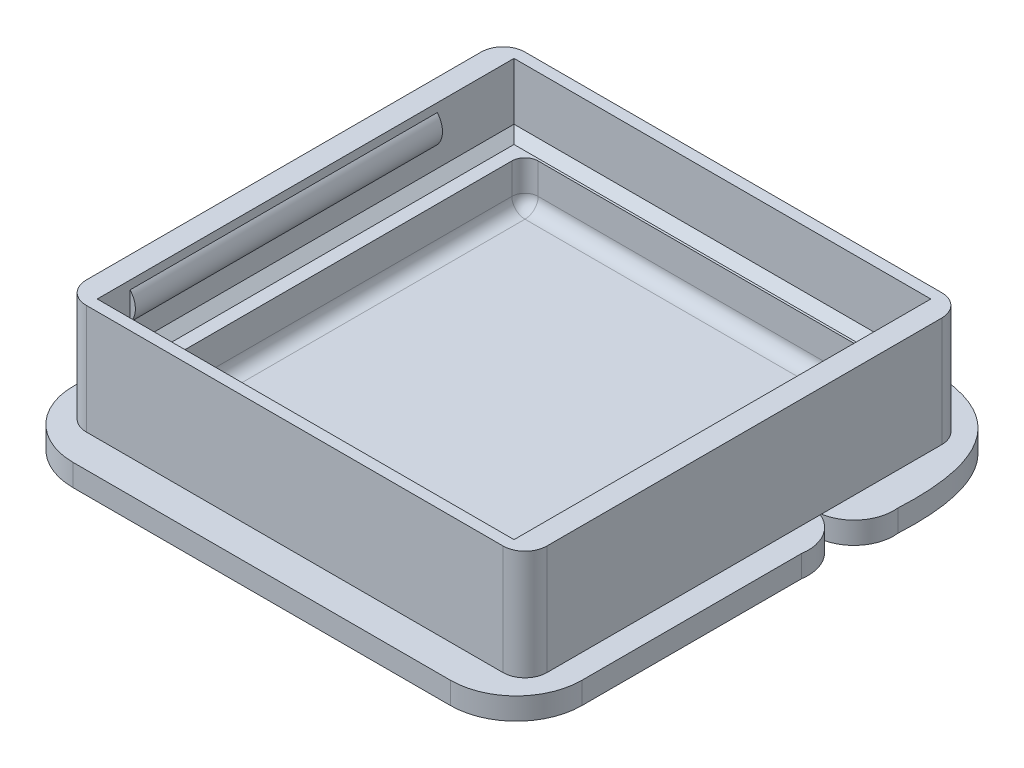
from build123d import *

# Parameters (mm, degrees)
BOSS_EXTRUDE1_DEPTH      = 6.35
SKETCH3_W                = 133.35
SKETCH3_H                = 127
SKETCH3_W_2              = 107.95
SKETCH3_H_2              = 114.3
BOSS_EXTRUDE2_DEPTH      = 12.7
SKETCH4_W                = 133.35
SKETCH4_H                = 127
SKETCH4_W_2              = 120.65
SKETCH4_H_2              = 120.65
BOSS_EXTRUDE3_DEPTH      = 19.05
FILLET1_R                = 6.35
FILLET2_R                = 3.81
BOSS_EXTRUDE4_DEPTH      = 50.8
BOSS_EXTRUDE4_DEPTH_BACK = 38.1
CHAMFER1_SIZE            = 2.54
CUT_EXTRUDE1_DEPTH       = 2.54
FILLET3_R                = 3.81


with BuildPart() as part:
    # Sketch2 → Boss-Extrude1 (new body)
    with BuildSketch(Plane(origin=(0, 0, 0), x_dir=(1, 0, 0), z_dir=(0, 1, 0))):
        with BuildLine():
            ThreePointArc((-76.2, 34.925), (-73.750256121, 26.470795103), (-66.04, 22.225))
            ThreePointArc((-66.04, 22.225), (-71.103893825, 18.75335434), (-73.66, 13.171090867))
            Line((-73.66, 13.171090867), (-73.66, -53.975))
            ThreePointArc((-73.66, -53.975), (-68.080384182, -67.445384182), (-54.61, -73.025))
            Line((-54.61, -73.025), (54.61, -73.025))
            ThreePointArc((54.61, -73.025), (68.080384182, -67.445384182), (73.66, -53.975))
            Line((73.66, -53.975), (73.66, 9.525))
            ThreePointArc((73.66, 9.525), (72.166535166, 17.2649211), (66.04, 22.225))
            ThreePointArc((66.04, 22.225), (73.750256121, 26.470795103), (76.2, 34.925))
            add(Edge.make_bspline(
                [(54.26154132, 73.334062346), (78.033661383, 68.772092229), (76.2, 34.925)],
                knots=[0, 0, 0, 1, 1, 1], degree=2))
            ThreePointArc((54.26154132, 73.334062346), (0, 79.119757765), (-54.26154132, 73.334062346))
            add(Edge.make_bspline(
                [(-54.26154132, 73.334062346), (-78.033661383, 68.772092229), (-76.2, 34.925)],
                knots=[0, 0, 0, 1, 1, 1], degree=2))
        make_face()
    extrude(amount=BOSS_EXTRUDE1_DEPTH)

    # Sketch3 → Boss-Extrude2 (add)
    with BuildSketch(Plane(origin=(0, 6.35, 0), x_dir=(1, 0, 0), z_dir=(0, 1, 0))):
        Rectangle(SKETCH3_W, SKETCH3_H)
        Rectangle(SKETCH3_W_2, SKETCH3_H_2, mode=Mode.SUBTRACT)
    extrude(amount=BOSS_EXTRUDE2_DEPTH)

    # Sketch4 → Boss-Extrude3 (add)
    with BuildSketch(Plane(origin=(0, 19.05, 0), x_dir=(1, 0, 0), z_dir=(0, 1, 0))):
        Rectangle(SKETCH4_W, SKETCH4_H)
        Rectangle(SKETCH4_W_2, SKETCH4_H_2, mode=Mode.SUBTRACT)
    extrude(amount=BOSS_EXTRUDE3_DEPTH)

    # Fillet1
    fillet1_edges = [part.edges().sort_by_distance(p)[0] for p in [
        (66.675, 22.225, 63.5),
        (66.675, 22.225, -63.5),
        (-66.675, 22.225, -63.5),
        (-66.675, 22.225, 63.5),
    ]]
    fillet(fillet1_edges, radius=FILLET1_R)

    # Fillet2
    fillet2_edges = [part.edges().sort_by_distance(p)[0] for p in [
        (53.975, 6.35, 0),
        (0, 6.35, -57.15),
        (-53.975, 6.35, 0),
        (0, 6.35, 57.15),
    ]]
    fillet(fillet2_edges, radius=FILLET2_R)

    # Sketch5 → Boss-Extrude4 (add, two sides: drawn at the far end of the back side and taken through both)
    with BuildSketch(Plane.XY.offset(-BOSS_EXTRUDE4_DEPTH_BACK)):
        with BuildLine():
            Line((60.325, 35.622124998), (60.325, 27.557875002))
            ThreePointArc((60.325, 27.557875002), (58.801, 31.59), (60.325, 35.622124998))
        make_face()
        with BuildLine():
            Line((-60.325, 35.622124998), (-60.325, 27.557875002))
            ThreePointArc((-60.325, 27.557875002), (-58.801, 31.59), (-60.325, 35.622124998))
        make_face()
    extrude(amount=BOSS_EXTRUDE4_DEPTH + BOSS_EXTRUDE4_DEPTH_BACK)

    # Chamfer1
    chamfer1_edges = [part.edges().sort_by_distance(p)[0] for p in [
        (60.325, 19.05, 0),
        (0, 19.05, -60.325),
        (-60.325, 19.05, 0),
        (0, 19.05, 60.325),
    ]]
    chamfer(chamfer1_edges, length=CHAMFER1_SIZE)

    # Sketch6 → Cut-Extrude1 (cut)
    with BuildSketch(Plane.XZ):
        with BuildLine():
            Line((-8.66439326, 21.686134934), (-9.134144863, 21.256347274))
            add(Edge.make_bspline(
                [(-9.134144863, 21.256347274), (-9.154267007, 21.284731651), (-9.192898718, 21.339225695), (-9.255516693, 21.412194506), (-9.317851915, 21.474442331), (-9.380481882, 21.525709129), (-9.443961724, 21.565683416), (-9.508181248, 21.593985652), (-9.572776375, 21.611977652), (-9.61617433, 21.614218089), (-9.637550312, 21.615321633)],
                knots=[0, 0, 0, 0, 1.299362458, 2.494594718, 3.587462134, 4.587049575, 5.512617175, 6.380583204, 7.202344345, 8, 8, 8, 8], degree=3))
            add(Edge.make_bspline(
                [(-9.637550312, 21.615321633), (-9.657489214, 21.614622377), (-9.695985996, 21.613272298), (-9.750866016, 21.599852609), (-9.799589278, 21.576692196), (-9.842108233, 21.546408009), (-9.875789517, 21.509922584), (-9.902681412, 21.471658754), (-9.917823808, 21.42942414), (-9.919816845, 21.400415703), (-9.920803517, 21.386054806)],
                knots=[0, 0, 0, 0, 1.185010067, 2.2879431, 3.333075148, 4.379039566, 5.372662701, 6.27520591, 7.14612461, 8, 8, 8, 8], degree=3))
            add(Edge.make_bspline(
                [(-9.920803517, 21.386054806), (-9.92018522, 21.371486819), (-9.918940055, 21.342148916), (-9.906913461, 21.299150566), (-9.88878595, 21.257136173), (-9.871464373, 21.231560013), (-9.862610408, 21.218486697)],
                knots=[0, 0, 0, 0, 0.967525499, 1.948461899, 2.951351359, 4, 4, 4, 4], degree=3))
            add(Edge.make_bspline(
                [(-9.862610408, 21.218486697), (-9.854561195, 21.208324945), (-9.836032971, 21.184933935), (-9.800703442, 21.147886221), (-9.756336973, 21.102499528), (-9.701226249, 21.050334572), (-9.637659069, 20.989515298), (-9.56268901, 20.922432533), (-9.478474038, 20.847008802), (-9.418615988, 20.794486448), (-9.387249831, 20.766964261)],
                knots=[0, 0, 0, 0, 0.473873513, 1.090794244, 1.870441696, 2.795289791, 3.865433203, 5.087734844, 6.473946851, 8, 8, 8, 8], degree=3))
            add(Edge.make_bspline(
                [(-9.387249831, 20.766964261), (-9.35780818, 20.741483998), (-9.301934044, 20.693127752), (-9.222436245, 20.624493824), (-9.152570919, 20.562745553), (-9.091320289, 20.508809648), (-9.039612854, 20.462120197), (-8.997231237, 20.422454026), (-8.963657817, 20.390583363), (-8.944573293, 20.371333463), (-8.936428517, 20.363118107)],
                knots=[0, 0, 0, 0, 1.543621617, 2.929473131, 4.163658386, 5.240097082, 6.164993805, 6.925417477, 7.541396219, 8, 8, 8, 8], degree=3))
            add(Edge.make_bspline(
                [(-8.936428517, 20.363118107), (-8.905528932, 20.329678139), (-8.846129079, 20.265394777), (-8.768930211, 20.165775782), (-8.705393044, 20.06852733), (-8.656239488, 19.971819534), (-8.619116745, 19.874257093), (-8.592944719, 19.773447293), (-8.577270119, 19.668336735), (-8.575529872, 19.596611611), (-8.57464967, 19.560333652)],
                knots=[0, 0, 0, 0, 1.206664779, 2.319633467, 3.337109185, 4.282041471, 5.190008762, 6.099243693, 7.03861361, 8, 8, 8, 8], degree=3))
            add(Edge.make_bspline(
                [(-8.57464967, 19.560333652), (-8.575276176, 19.524985231), (-8.576505402, 19.455630312), (-8.59156107, 19.35413972), (-8.613029568, 19.257008818), (-8.646223633, 19.165294529), (-8.686680363, 19.07749139), (-8.737398716, 18.994967094), (-8.796960468, 18.916886463), (-8.865227381, 18.844645283), (-8.940738693, 18.779091419), (-9.021731751, 18.720733822), (-9.108998547, 18.672552191), (-9.201793487, 18.632878055), (-9.300066899, 18.602320505), (-9.403701711, 18.579735628), (-9.512856439, 18.566180541), (-9.587498015, 18.564763517), (-9.625631241, 18.564039582)],
                knots=[0, 0, 0, 0, 1.043214005, 2.046824704, 3.02475056, 3.976699089, 4.921714032, 5.875962561, 6.831408892, 7.817874052, 8.806269674, 9.781291748, 10.760897367, 11.74438705, 12.757449933, 13.795994037, 14.874007457, 16, 16, 16, 16], degree=3))
            add(Edge.make_bspline(
                [(-9.625631241, 18.564039582), (-9.655565499, 18.564570635), (-9.714852496, 18.565622426), (-9.802232568, 18.574209423), (-9.886607905, 18.588067922), (-9.967883465, 18.607931291), (-10.046425411, 18.633100874), (-10.122236967, 18.663844555), (-10.194794781, 18.70063885), (-10.26464786, 18.742727121), (-10.331456632, 18.791597149), (-10.396065866, 18.8462498), (-10.457833804, 18.907525658), (-10.517057104, 18.975279807), (-10.573356839, 19.049704111), (-10.628575901, 19.129762074), (-10.680260189, 19.216939462), (-10.712187872, 19.278095105), (-10.728495824, 19.30933205)],
                knots=[0, 0, 0, 0, 1.016823716, 2.013894106, 2.979844003, 3.91962641, 4.853723003, 5.779685073, 6.695824784, 7.614987388, 8.547259901, 9.504950863, 10.487499108, 11.500346958, 12.559593716, 13.656357062, 14.802919212, 16, 16, 16, 16], degree=3))
            Line((-10.728495824, 19.30933205), (-10.17601185, 19.640962659))
            add(Edge.make_bspline(
                [(-10.17601185, 19.640962659), (-10.155613039, 19.605504645), (-10.116506776, 19.537528602), (-10.050237557, 19.446194173), (-9.982348125, 19.367981353), (-9.911268937, 19.304272559), (-9.83786429, 19.254215922), (-9.761779623, 19.218441977), (-9.682961479, 19.196297945), (-9.62927414, 19.193593648), (-9.602494222, 19.19224471)],
                knots=[0, 0, 0, 0, 1.283663364, 2.460892379, 3.537111102, 4.529833553, 5.449777664, 6.316464042, 7.160231139, 8, 8, 8, 8], degree=3))
            add(Edge.make_bspline(
                [(-9.602494222, 19.19224471), (-9.575255211, 19.193346326), (-9.522407562, 19.19548362), (-9.446974307, 19.215225167), (-9.377814242, 19.246220845), (-9.318032793, 19.290447402), (-9.267413631, 19.341491571), (-9.230053784, 19.398280543), (-9.206584076, 19.45972484), (-9.204102759, 19.50240809), (-9.202854799, 19.523875319)],
                knots=[0, 0, 0, 0, 1.13588714, 2.203786484, 3.234766741, 4.283437687, 5.291419208, 6.222934724, 7.106237994, 8, 8, 8, 8], degree=3))
            add(Edge.make_bspline(
                [(-9.202854799, 19.523875319), (-9.204007239, 19.543847082), (-9.206348311, 19.584417807), (-9.223591927, 19.644739952), (-9.250548958, 19.705034663), (-9.282441027, 19.754490017), (-9.3148952, 19.795897643), (-9.34592871, 19.831775479), (-9.383719316, 19.871414206), (-9.428171197, 19.914863687), (-9.478697028, 19.96250642), (-9.535339371, 20.014337738), (-9.59874684, 20.069901069), (-9.643563364, 20.107750262), (-9.666997427, 20.127541184)],
                knots=[0, 0, 0, 0, 0.916159276, 1.861089862, 2.860218735, 3.940849679, 4.552606315, 5.27541173, 6.11797699, 7.06649574, 8.129236253, 9.306560635, 10.591630461, 12, 12, 12, 12], degree=3))
            add(Edge.make_bspline(
                [(-9.666997427, 20.127541184), (-9.711546513, 20.165233983), (-9.797049694, 20.237577873), (-9.917876537, 20.344427522), (-10.02675234, 20.444288308), (-10.122736737, 20.538394731), (-10.207052716, 20.625008863), (-10.279129254, 20.704834216), (-10.338174556, 20.778486535), (-10.400307004, 20.865722778), (-10.459345253, 20.972026134), (-10.510371054, 21.099921394), (-10.543474439, 21.227800426), (-10.547183213, 21.313651365), (-10.549008645, 21.355906569)],
                knots=[0, 0, 0, 0, 1.345494975, 2.582412109, 3.71882943, 4.751509156, 5.681369928, 6.505683931, 7.230279997, 7.856715994, 8.973648664, 10.023341002, 11.027102913, 12, 12, 12, 12], degree=3))
            add(Edge.make_bspline(
                [(-10.549008645, 21.355906569), (-10.54824945, 21.385871691), (-10.546753756, 21.444906201), (-10.533411928, 21.531707846), (-10.513472059, 21.615464141), (-10.484513644, 21.695869503), (-10.446929119, 21.772823222), (-10.401284172, 21.846702019), (-10.346870025, 21.91682593), (-10.285548955, 21.983148468), (-10.217988836, 22.04375972), (-10.145792263, 22.097255224), (-10.069367875, 22.142438304), (-9.989183198, 22.179920949), (-9.90474136, 22.208611534), (-9.816664442, 22.22894885), (-9.724826112, 22.241044837), (-9.662359663, 22.242689146), (-9.630539094, 22.243526761)],
                knots=[0, 0, 0, 0, 1.010766082, 1.991317756, 2.957454644, 3.913069143, 4.869106762, 5.843196583, 6.838735724, 7.860187025, 8.887984031, 9.89767229, 10.887916223, 11.879572884, 12.879850636, 13.892031539, 14.926195476, 16, 16, 16, 16], degree=3))
            add(Edge.make_bspline(
                [(-9.630539094, 22.243526761), (-9.589301211, 22.242018192), (-9.507150963, 22.239012961), (-9.385689452, 22.215513035), (-9.267050927, 22.178556928), (-9.17144978, 22.13397345), (-9.095381731, 22.090785414), (-9.037082678, 22.05102331), (-8.977760253, 22.005473684), (-8.916936058, 21.953992995), (-8.855740301, 21.895611281), (-8.792432894, 21.831718364), (-8.727876477, 21.761762059), (-8.685925042, 21.711785599), (-8.66439326, 21.686134934)],
                knots=[0, 0, 0, 0, 1.282922637, 2.555718331, 3.837320111, 5.142675274, 5.830281639, 6.55870424, 7.337177975, 8.157850921, 9.037902056, 9.96903443, 10.957596896, 12, 12, 12, 12], degree=3))
        make_face()
        with BuildLine():
            Line((-7.049008645, 22.153783172), (-6.420803517, 22.153783172))
            Line((-6.420803517, 22.153783172), (-6.420803517, 19.830265543))
            add(Edge.make_bspline(
                [(-6.420803517, 19.830265543), (-6.421033835, 19.785856838), (-6.421477614, 19.700290031), (-6.425920629, 19.577105414), (-6.431928368, 19.464163505), (-6.440580092, 19.361645273), (-6.453430271, 19.269555675), (-6.467972772, 19.187664956), (-6.484017187, 19.115639434), (-6.511120141, 19.03503167), (-6.553196692, 18.945767741), (-6.616691408, 18.849350012), (-6.695762653, 18.765579436), (-6.786826609, 18.692815007), (-6.890650557, 18.635199344), (-7.004842637, 18.593554589), (-7.129037805, 18.568675723), (-7.215058576, 18.565615233), (-7.259345183, 18.564039582)],
                knots=[0, 0, 0, 0, 1.22248561, 2.355488409, 3.392943897, 4.335991845, 5.186735882, 5.951517034, 6.625683685, 7.215700098, 8.28923535, 9.333114649, 10.380102123, 11.447198135, 12.530158036, 13.633358744, 14.781567393, 16, 16, 16, 16], degree=3))
            add(Edge.make_bspline(
                [(-7.259345183, 18.564039582), (-7.305487798, 18.565468104), (-7.396499053, 18.568285708), (-7.529976432, 18.592284456), (-7.658264878, 18.630761671), (-7.780700695, 18.686395105), (-7.898961291, 18.756083498), (-8.010900344, 18.842525167), (-8.118854988, 18.943039176), (-8.18285116, 19.020171104), (-8.215675312, 19.059732691)],
                knots=[0, 0, 0, 0, 0.990984786, 1.954608977, 2.90473533, 3.862451285, 4.837525908, 5.848096122, 6.896271184, 8, 8, 8, 8], degree=3))
            Line((-8.215675312, 19.059732691), (-7.740314735, 19.499336056))
            add(Edge.make_bspline(
                [(-7.740314735, 19.499336056), (-7.715425391, 19.471193238), (-7.668850739, 19.418530459), (-7.598664111, 19.349856901), (-7.53535199, 19.294685624), (-7.475669617, 19.254890086), (-7.419348793, 19.226838673), (-7.365177736, 19.206632452), (-7.311467858, 19.195194584), (-7.275985474, 19.193213118), (-7.258644062, 19.19224471)],
                knots=[0, 0, 0, 0, 1.529509877, 2.862124173, 3.996688592, 4.944357383, 5.774364335, 6.554177287, 7.293378699, 8, 8, 8, 8], degree=3))
            add(Edge.make_bspline(
                [(-7.258644062, 19.19224471), (-7.241859504, 19.193119998), (-7.209588319, 19.194802888), (-7.165214202, 19.213510347), (-7.127803965, 19.242881845), (-7.103175273, 19.276648193), (-7.087480279, 19.311166491), (-7.07767375, 19.344533732), (-7.068367338, 19.384532011), (-7.060911248, 19.431141281), (-7.055277413, 19.484969495), (-7.052469353, 19.545363183), (-7.049054393, 19.612648703), (-7.049024436, 19.659653477), (-7.049008645, 19.68443221)],
                knots=[0, 0, 0, 0, 1.003927327, 1.930222208, 2.840933547, 3.835773585, 4.407906147, 5.114514582, 5.922289074, 6.876303333, 7.950072246, 9.174518422, 10.510537432, 12, 12, 12, 12], degree=3))
            Line((-7.049008645, 19.68443221), (-7.049008645, 22.153783172))
        make_face()
        Polygon((-5.613111209, 22.153783172), (-4.984906081, 22.153783172), (-4.984906081, 20.921912178), (-3.992117619, 22.153783172), (-3.199148869, 22.153783172), (-4.446444542, 20.605706248), (-3.077854799, 18.653783172), (-3.834365215, 18.653783172), (-4.984906081, 20.295109293), (-4.984906081, 18.653783172), (-5.613111209, 18.653783172), align=None)
        Polygon((-2.606700953, 22.153783172), (-0.722085568, 22.153783172), (-0.722085568, 21.525578043), (-1.978495824, 21.525578043), (-1.978495824, 20.85250112), (-0.722085568, 20.85250112), (-0.722085568, 20.224295992), (-1.978495824, 20.224295992), (-1.978495824, 19.2819883), (-0.722085568, 19.2819883), (-0.722085568, 18.653783172), (-2.606700953, 18.653783172), align=None)
        Polygon((-0.09388044, 22.153783172), (0.534324688, 22.153783172), (0.534324688, 19.2819883), (1.521504176, 19.2819883), (1.521504176, 18.653783172), (-0.09388044, 18.653783172), align=None)
        Polygon((2.059965714, 22.153783172), (2.688170842, 22.153783172), (2.688170842, 19.2819883), (3.67535033, 19.2819883), (3.67535033, 18.653783172), (2.059965714, 18.653783172), align=None)
        Polygon((3.922145201, 22.153783172), (4.621163631, 22.153783172), (5.24586315, 20.926118909), (5.870562669, 22.153783172), (6.569581099, 22.153783172), (5.559965714, 20.169608492), (5.559965714, 18.653783172), (4.931760586, 18.653783172), (4.931760586, 20.169608492), align=None)
    extrude(amount=-CUT_EXTRUDE1_DEPTH, mode=Mode.SUBTRACT)

    # Fillet3
    # the kernel refuses this fillet: 3.81 mm, written as the material it adds along each edge
    with BuildSketch(Plane(origin=(50.165, 10.16, -53.34), x_dir=(1, 0, 0), z_dir=(0, 0, -1))) as fillet3_piece_1_section:
        Polygon((0, 0), (FILLET3_R, 0), (FILLET3_R, FILLET3_R), (0, FILLET3_R), align=None)
    fillet3_piece_1 = extrude(amount=FILLET3_R, mode=Mode.PRIVATE)
    fillet3_piece_1 = fillet3_piece_1 - Plane(origin=(50.165, 10.16, -53.34), x_dir=(-0.7071067811865475, 0.7071067811865475, 0), z_dir=(0, 0, -1)) * Sphere(FILLET3_R, mode=Mode.PRIVATE)
    add(fillet3_piece_1)
    with BuildSketch(Plane(origin=(50.165, 10.16, 53.34), x_dir=(1, 0, 0), z_dir=(0, 0, 1))) as fillet3_piece_2_section:
        Polygon((0, 0), (FILLET3_R, 0), (FILLET3_R, -FILLET3_R), (0, -FILLET3_R), align=None)
    fillet3_piece_2 = extrude(amount=FILLET3_R, mode=Mode.PRIVATE)
    fillet3_piece_2 = fillet3_piece_2 - Plane(origin=(50.165, 10.16, 53.34), x_dir=(-0.7071067811865475, 0.7071067811865475, 0), z_dir=(0, 0, 1)) * Sphere(FILLET3_R, mode=Mode.PRIVATE)
    add(fillet3_piece_2)
    with BuildSketch(Plane(origin=(-50.165, 10.16, -53.34), x_dir=(0, 0, -1), z_dir=(-1, 0, 0))) as fillet3_piece_3_section:
        Polygon((0, 0), (FILLET3_R, 0), (FILLET3_R, FILLET3_R), (0, FILLET3_R), align=None)
    fillet3_piece_3 = extrude(amount=FILLET3_R, mode=Mode.PRIVATE)
    fillet3_piece_3 = fillet3_piece_3 - Plane(origin=(-50.165, 10.16, -53.34), x_dir=(0, 0.7071067811865475, 0.7071067811865475), z_dir=(-1, 0, 0)) * Sphere(FILLET3_R, mode=Mode.PRIVATE)
    add(fillet3_piece_3)
    with BuildSketch(Plane(origin=(-50.165, 10.16, 53.34), x_dir=(0, 0, 1), z_dir=(-1, 0, 0))) as fillet3_piece_4_section:
        Polygon((0, 0), (FILLET3_R, 0), (FILLET3_R, -FILLET3_R), (0, -FILLET3_R), align=None)
    fillet3_piece_4 = extrude(amount=FILLET3_R, mode=Mode.PRIVATE)
    fillet3_piece_4 = fillet3_piece_4 - Plane(origin=(-50.165, 10.16, 53.34), x_dir=(0, 0.7071067811865475, -0.7071067811865475), z_dir=(-1, 0, 0)) * Sphere(FILLET3_R, mode=Mode.PRIVATE)
    add(fillet3_piece_4)
    with BuildSketch(Plane(origin=(53.975, 10.16, -57.15), x_dir=(-1, 0, 0), z_dir=(0, 1, 0)), Plane(origin=(-53.975, 10.16, -57.15), x_dir=(0, 0, 1), z_dir=(0, 1, 0))) as fillet3_piece_5:
        with BuildLine():
            CenterArc((FILLET3_R, FILLET3_R), FILLET3_R, 180, 90)
            Line((0, FILLET3_R), (0, 0))
            Line((0, 0), (FILLET3_R, 0))
        make_face()
    extrude(amount=8.89)
    with BuildSketch(Plane(origin=(-53.975, 10.16, 57.15), x_dir=(0, 0, -1), z_dir=(0, 1, 0)), Plane(origin=(53.975, 10.16, 57.15), x_dir=(-1, 0, 0), z_dir=(0, 1, 0))) as fillet3_piece_6:
        with BuildLine():
            CenterArc((FILLET3_R, -FILLET3_R), FILLET3_R, 90, 90)
            Line((0, -FILLET3_R), (0, 0))
            Line((0, 0), (FILLET3_R, 0))
        make_face()
    extrude(amount=8.89)


solid = part.part
